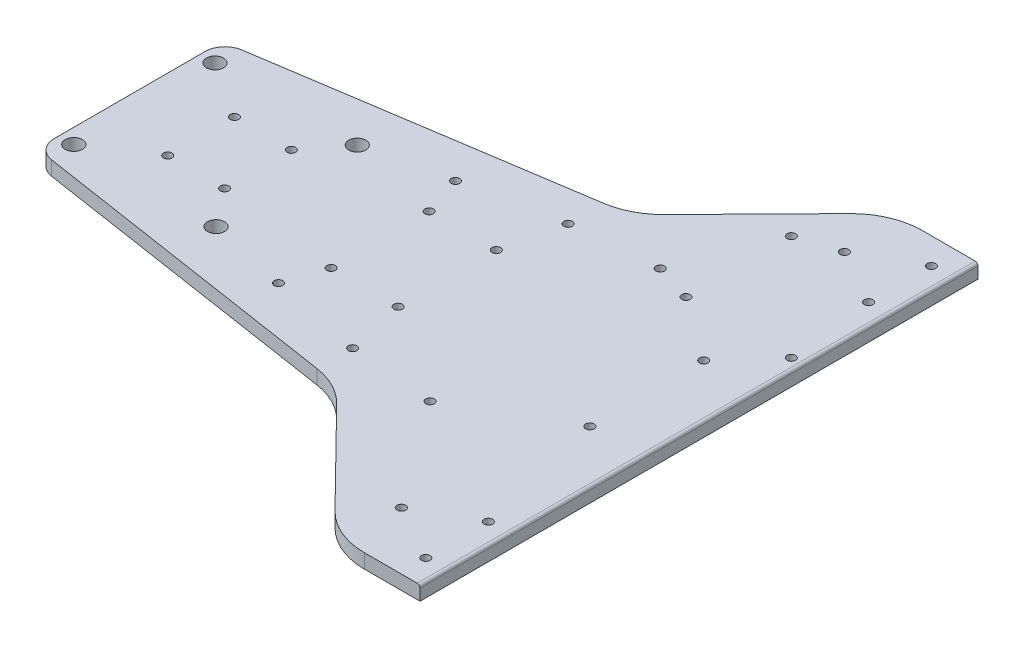
from build123d import *

# Parameters (mm, degrees)
BOSS_EXTRU_1_DEPTH      = 5
CONG_3_R                = 7
ESQUISSE3_R             = 3
ENL_V_MAT_EXTRU_1_DEPTH = 5
CONG_2_R                = 1
ESQUISSE4_R             = 1.503847334
ESQUISSE4_R_2           = 1.498131622
ESQUISSE4_R_3           = 1.50323989
ENL_V_MAT_EXTRU_2_DEPTH = 10
ESQUISSE6_R             = 1.5
ENL_V_MAT_EXTRU_3_DEPTH = 10
ESQUISSE7_R             = 1.5
ENL_V_MAT_EXTRU_4_DEPTH = 10
ESQUISSE8_R             = 1.5
ENL_V_MAT_EXTRU_5_DEPTH = 10
ESQUISSE10_R            = 1.5
ENL_V_MAT_EXTRU_6_DEPTH = 10


with BuildPart() as part:
    # Esquisse1 → Boss.-Extru.1 (new body)
    with BuildSketch(Plane(origin=(0, 0, 0), x_dir=(1, 0, 0), z_dir=(0, 1, 0))):
        with BuildLine():
            Line((200, 98), (180.486918987, 98))
            ThreePointArc((180.486918987, 98), (170.816361757, 96.053857006), (162.651427502, 90.518425828))
            Line((162.651427502, 90.518425828), (130.227508241, 57.507666668))
            ThreePointArc((130.227508241, 57.507666668), (123.786759953, 52.773905469), (116.181163829, 50.314913559))
            Line((116.181163829, 50.314913559), (0, 32.5))
            Line((0, 32.5), (0, 19.62474242))
            Line((0, 19.62474242), (0, -19.62474242))
            Line((0, -19.62474242), (0, -32.5))
            Line((0, -32.5), (116.181163829, -50.314913559))
            ThreePointArc((116.181163829, -50.314913559), (123.786759953, -52.773905469), (130.227508241, -57.507666668))
            Line((130.227508241, -57.507666668), (162.651427502, -90.518425828))
            ThreePointArc((162.651427502, -90.518425828), (170.816361757, -96.053857006), (180.486918987, -98))
            Line((180.486918987, -98), (200, -98))
            Line((200, -98), (200, 98))
        make_face()
    extrude(amount=BOSS_EXTRU_1_DEPTH)

    # Congé3
    cong_3_edges = [part.edges().sort_by_distance(p)[0] for p in [
        (0, 2.5, 32.5),
        (0, 2.5, -32.5),
    ]]
    fillet(cong_3_edges, radius=CONG_3_R)

    # Esquisse3 → Enlèv. mat.-Extru.1 (cut)
    with BuildSketch(Plane(origin=(0, 5, 0), x_dir=(1, 0, 0), z_dir=(0, 1, 0))):
        with Locations((5.228132429, -24.85729672)):
            Circle(ESQUISSE3_R)
        with Locations((5.228132429, 24.743581245)):
            Circle(ESQUISSE3_R)
        with Locations((55.20842969, -24.85729672)):
            Circle(ESQUISSE3_R)
        with Locations((55.20842969, 24.743581245)):
            Circle(ESQUISSE3_R)
    extrude(amount=-ENL_V_MAT_EXTRU_1_DEPTH, mode=Mode.SUBTRACT)

    # Congé2
    cong_2_edges = [part.edges().sort_by_distance(p)[0] for p in [
        (200, 5, 0),
    ]]
    fillet(cong_2_edges, radius=CONG_2_R)

    # Esquisse4 → Enlèv. mat.-Extru.2 (cut)
    with BuildSketch(Plane(origin=(0, 5, 0), x_dir=(1, 0, 0), z_dir=(0, 1, 0))):
        with Locations((192.801268115, -66.778012946)):
            Circle(ESQUISSE4_R)
        with Locations((192.824609704, -88.804759655)):
            Circle(ESQUISSE4_R_2)
        with Locations((173.269117951, -77.791386301)):
            Circle(ESQUISSE4_R_3)
        with Locations((173.269117951, 77.791386301)):
            Circle(ESQUISSE4_R_3)
        with Locations((192.824609704, 88.804759655)):
            Circle(ESQUISSE4_R_2)
        with Locations((192.801268115, 66.778012946)):
            Circle(ESQUISSE4_R)
    extrude(amount=-ENL_V_MAT_EXTRU_2_DEPTH, mode=Mode.SUBTRACT)

    # Esquisse6 → Enlèv. mat.-Extru.3 (cut)
    with BuildSketch(Plane(origin=(0, 5, 0), x_dir=(1, 0, 0), z_dir=(0, 1, 0))):
        with Locations((181.582963716, 20.060076368)):
            Circle(ESQUISSE6_R)
        with Locations((181.63025752, -19.977667143)):
            Circle(ESQUISSE6_R)
    extrude(amount=-ENL_V_MAT_EXTRU_3_DEPTH, mode=Mode.SUBTRACT)

    # Esquisse7 → Enlèv. mat.-Extru.4 (cut)
    with BuildSketch(Plane(origin=(0, 5, 0), x_dir=(1, 0, 0), z_dir=(0, 1, 0))):
        with Locations((145.949264841, 40.414479314)):
            Circle(ESQUISSE7_R)
        with Locations((145.949264841, -40.414479314)):
            Circle(ESQUISSE7_R)
    extrude(amount=-ENL_V_MAT_EXTRU_4_DEPTH, mode=Mode.SUBTRACT)

    # Esquisse8 → Enlèv. mat.-Extru.5 (cut)
    with BuildSketch(Plane(origin=(0, 5, 0), x_dir=(1, 0, 0), z_dir=(0, 1, 0))):
        with Locations((196.148923391, 36.274574464)):
            Circle(ESQUISSE8_R)
        with Locations((159.148923391, 73.274574464)):
            Circle(ESQUISSE8_R)
        with Locations((159.148923391, 36.274574464)):
            Circle(ESQUISSE8_R)
    extrude(amount=-ENL_V_MAT_EXTRU_5_DEPTH, mode=Mode.SUBTRACT)

    # Esquisse10 → Enlèv. mat.-Extru.6 (cut)
    with BuildSketch(Plane(origin=(0, 5, 0), x_dir=(1, 0, 0), z_dir=(0, 1, 0))):
        with Locations((25.07306574, 11.722723168)):
            Circle(ESQUISSE10_R)
        with Locations((45.07306574, 11.722723168)):
            Circle(ESQUISSE10_R)
        with Locations((25.07306574, -11.722723168)):
            Circle(ESQUISSE10_R)
        with Locations((45.07306574, -11.722723168)):
            Circle(ESQUISSE10_R)
        with Locations((116.197121489, 37.845919086)):
            Circle(ESQUISSE10_R)
        with Locations((83.356052247, 31.079856582)):
            Circle(ESQUISSE10_R)
        with Locations((116.197121489, -37.845919086)):
            Circle(ESQUISSE10_R)
        with Locations((83.356052247, -31.079856582)):
            Circle(ESQUISSE10_R)
        with Locations((111.5605905, 17.231443917)):
            Circle(ESQUISSE10_R)
        with Locations((87.992583236, 17.231443917)):
            Circle(ESQUISSE10_R)
        with Locations((87.992583236, -17.231443917)):
            Circle(ESQUISSE10_R)
        with Locations((111.5605905, -17.231443917)):
            Circle(ESQUISSE10_R)
    extrude(amount=-ENL_V_MAT_EXTRU_6_DEPTH, mode=Mode.SUBTRACT)


solid = part.part
